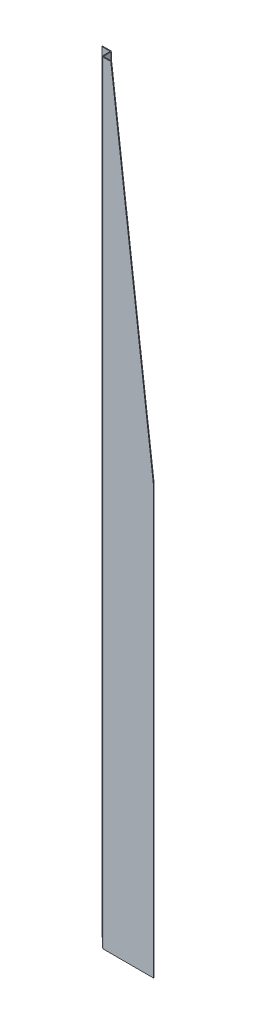
from build123d import *

# Parameters (mm, degrees)
BRIDA_BASE4_DEPTH          = 1810
CORTAR_EXTRUIR1_DEPTH      = 1812.921593226
CORTAR_EXTRUIR1_DEPTH_BACK = 1812.921593226
CORTAR_EXTRUIR2_DEPTH      = 1.9
CORTAR_EXTRUIR3_DEPTH      = 1812.899624703
CORTAR_EXTRUIR3_DEPTH_BACK = 1812.899624703
CROQUIS22_W                = 55.247943396
CROQUIS22_H                = 1.9


# Read off the part's stored shape, not the designer's step: Cortar-Extruir2
# Sheet-metal steps are written as plain solids
with BuildPart() as part:
    # Croquis1 → Brida base4 (new body)
    with BuildSketch(Plane(origin=(0, 0, 0), x_dir=(1, 0, 0), z_dir=(0, 1, 0))):
        with BuildLine():
            Line((60.5, 0), (-57.8634, 0))
            ThreePointArc((-57.8634, 0), (-59.727757739, 0.772242261), (-60.5, 2.6366))
            Line((-60.5, 2.6366), (-60.5, 19.2634))
            ThreePointArc((-60.5, 19.2634), (-60.715745145, 19.784254855), (-61.2366, 20))
            Line((-61.2366, 20), (-80.5, 20))
            Line((-80.5, 20), (-80.5, 21.9))
            Line((-80.5, 21.9), (-61.2366, 21.9))
            ThreePointArc((-61.2366, 21.9), (-59.372242261, 21.127757739), (-58.6, 19.2634))
            Line((-58.6, 19.2634), (-58.6, 2.6366))
            ThreePointArc((-58.6, 2.6366), (-58.384254855, 2.115745145), (-57.8634, 1.9))
            Line((-57.8634, 1.9), (60.5, 1.9))
            Line((60.5, 1.9), (60.5, 0))
        make_face()
    extrude(amount=BRIDA_BASE4_DEPTH)

    # Croquis19 → Cortar-Extruir1 (cut, two sides: drawn at the far end of the back side and taken through both)
    with BuildSketch(Plane.XY.offset(-CORTAR_EXTRUIR1_DEPTH_BACK)):
        Polygon((60.5, 1000), (-39.5, 1810), (-39.5, 1900.089959651), (60.5, 1900.089959651), align=None)
    extrude(amount=CORTAR_EXTRUIR1_DEPTH + CORTAR_EXTRUIR1_DEPTH_BACK, mode=Mode.SUBTRACT)

    # Cortar-Extruir2 outline → Cortar-Extruir2 (cut)
    with BuildSketch(Plane(origin=(0, 0, 0), x_dir=(1, 0, 0), z_dir=(0, 1, 0))):
        with BuildLine():
            Line((-57.8634, 0), (-57.8634, 1.9))
            ThreePointArc((-57.8634, 1.9), (-58.384254855, 2.115745145), (-58.6, 2.6366))
            Line((-58.6, 2.6366), (-58.6, 19.2634))
            ThreePointArc((-58.6, 19.2634), (-59.372242261, 21.127757739), (-61.2366, 21.9))
            Line((-61.2366, 21.9), (-80.5, 21.9))
            Line((-80.5, 21.9), (-80.5, 20))
            Line((-80.5, 20), (-61.2366, 20))
            ThreePointArc((-61.2366, 20), (-60.715745145, 19.784254855), (-60.5, 19.2634))
            Line((-60.5, 19.2634), (-60.5, 2.6366))
            ThreePointArc((-60.5, 2.6366), (-59.727757739, 0.772242261), (-57.8634, 0))
        make_face()
    extrude(amount=CORTAR_EXTRUIR2_DEPTH, mode=Mode.SUBTRACT)

    # Croquis22 → Cortar-Extruir3 (cut, two sides: drawn at the far end of the back side and taken through both)
    with BuildSketch(Plane.XY.offset(-20).offset(-CORTAR_EXTRUIR3_DEPTH_BACK)):
        with Locations((-52.876028302, 1809.05)):
            Rectangle(CROQUIS22_W, CROQUIS22_H)
    extrude(amount=CORTAR_EXTRUIR3_DEPTH + CORTAR_EXTRUIR3_DEPTH_BACK, mode=Mode.SUBTRACT)


solid = part.part
